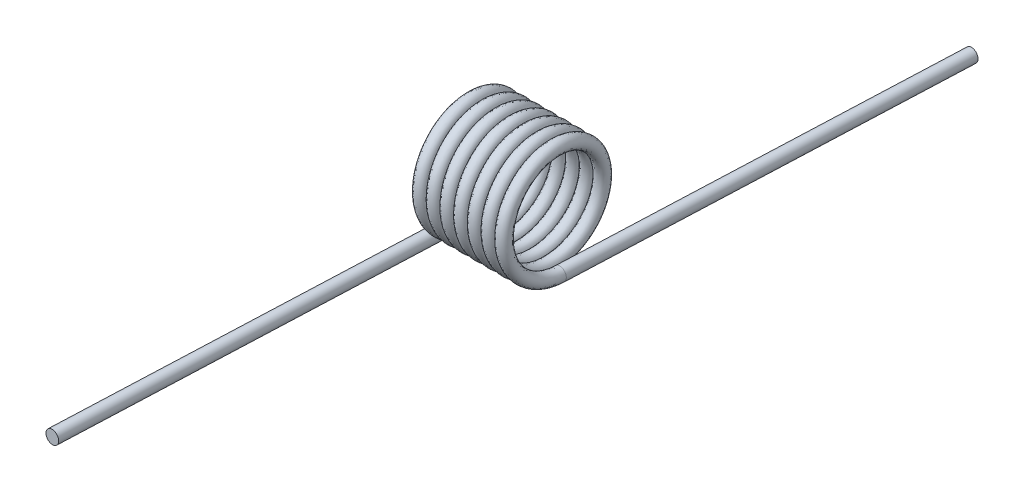
from build123d import *

# Parameters (mm, degrees)
SWEEP1_PITCH       = 0.6604
SWEEP1_HEIGHT      = 4.6228
SWEEP1_RADIUS      = 2.5273
SWEEP1_START_ANGLE = 90
SKETCH3_R          = 0.3175
SKETCH4_R          = 0.3175
EXTRUDE1_DEPTH     = 19.05
SKETCH5_R          = 0.3175
EXTRUDE2_DEPTH     = 19.05


with BuildPart() as part:
    # Sweep1: sweep along a helix
    with BuildLine() as sweep1_path:
        add(Helix(SWEEP1_PITCH, SWEEP1_HEIGHT, SWEEP1_RADIUS, center=(0, 0, 0), direction=(1, 0, 0), mode=Mode.PRIVATE).rotate(Axis((0, 0, 0), (1, 0, 0)), SWEEP1_START_ANGLE))
    # Sketch3 → Sweep1 (sweep)
    with BuildSketch(Plane(origin=(0, -2.5273, 0), x_dir=(0.9988665677845978, -0.02323612909274864, 0.04154108890006015), z_dir=(0.041552307827725815, 9.227644690024127e-15, -0.999136329894069))):
        Circle(SKETCH3_R)
    sweep(path=sweep1_path.line, is_frenet=True)

    # Sketch4 → Extrude1 (add)
    with BuildSketch(Plane(origin=(0, 0, 0), x_dir=(-0.9988665677845978, 0.02323612909274867, -0.04154108890006014), z_dir=(-0.04155230782772581, -9.227861530458624e-15, 0.999136329894069))):
        with Locations(Location((-0.058724669, 2.526617641, 0), (0, 0, 1.33145196))):
            Circle(SKETCH4_R)
    extrude(amount=EXTRUDE1_DEPTH)

    # Sketch5 → Extrude2 (add)
    with BuildSketch(Plane(origin=(0.0079817, 0, -0.191922108), x_dir=(0.9932619248702481, -0.10827925745558456, 0.04130800174199677), z_dir=(0.04155230782772582, 1.0687197654624114e-13, -0.999136329894069))):
        with Locations(Location((4.865305394, 2.012319744, 0), (0, 0, 173.78386821))):
            Circle(SKETCH5_R)
    extrude(amount=EXTRUDE2_DEPTH)


solid = part.part
